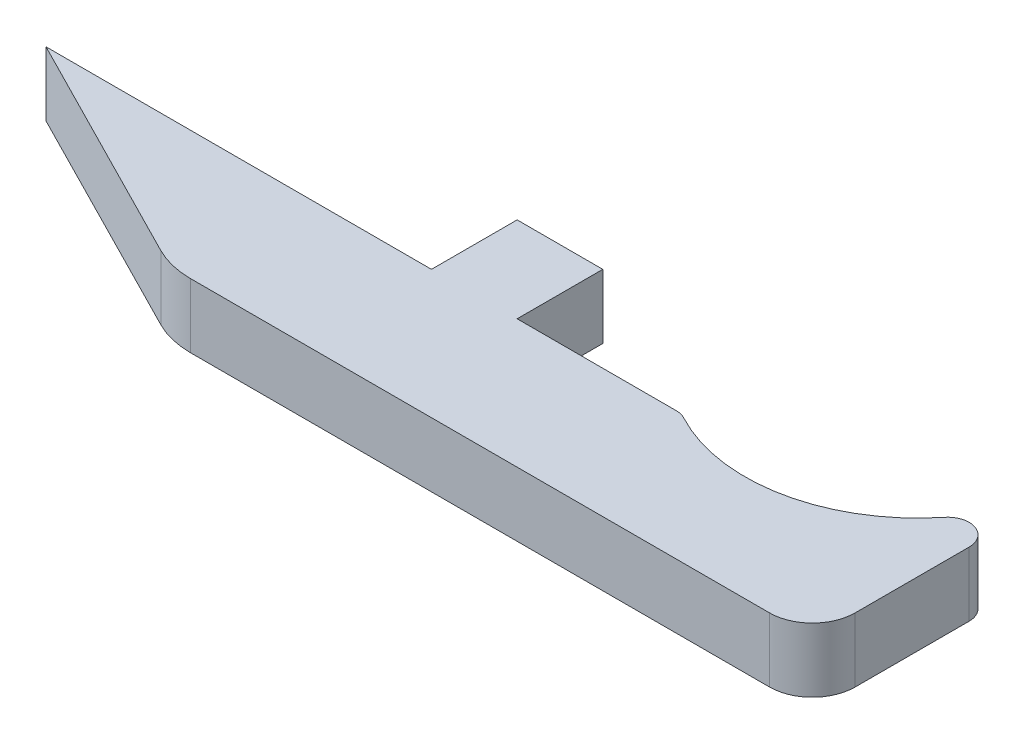
from build123d import *

# Parameters (mm, degrees)
BOSS_EXTRUDE1_DEPTH = 4.7625
FILLET1_R           = 1.5875
FILLET2_R           = 6.35
FILLET3_R           = 3.175
SKETCH6_W           = 6.35
SKETCH6_H           = 4.7625
BOSS_EXTRUDE2_DEPTH = 6.35


with BuildPart() as part:
    # Sketch1 → Boss-Extrude1 (new body)
    with BuildSketch(Plane(origin=(0, 0, 0), x_dir=(1, 0, 0), z_dir=(0, 1, 0))):
        with BuildLine():
            ThreePointArc((71.8566, 1.829231584), (65.45758311, -9.270901845), (52.645098926, -9.295968416))
            Line((52.645098926, -9.295968416), (5.5225, -9.295968416))
            Line((5.5225, -9.295968416), (24.2316, -18.820968416))
            Line((24.2316, -18.820968416), (71.8566, -18.820968416))
            Line((71.8566, -18.820968416), (71.8566, 1.829231584))
        make_face()
    extrude(amount=BOSS_EXTRUDE1_DEPTH)

    # Fillet1
    fillet1_edges = [part.edges().sort_by_distance(p)[0] for p in [
        (52.645098926, 2.38125, 9.295968416),
        (71.8566, 2.38125, -1.829231584),
    ]]
    fillet(fillet1_edges, radius=FILLET1_R)

    # Fillet2
    fillet2_edges = [part.edges().sort_by_distance(p)[0] for p in [
        (24.2316, 2.38125, 18.820968416),
    ]]
    fillet(fillet2_edges, radius=FILLET2_R)

    # Fillet3
    fillet3_edges = [part.edges().sort_by_distance(p)[0] for p in [
        (71.8566, 2.38125, 18.820968416),
    ]]
    fillet(fillet3_edges, radius=FILLET3_R)

    # Sketch6 → Boss-Extrude2 (add)
    with BuildSketch(Plane(origin=(0, 0, 9.295968416), x_dir=(-1, 0, 0), z_dir=(0, 0, -1))):
        with Locations((-37.2725, 2.38125)):
            Rectangle(SKETCH6_W, SKETCH6_H)
    extrude(amount=BOSS_EXTRUDE2_DEPTH)


solid = part.part
